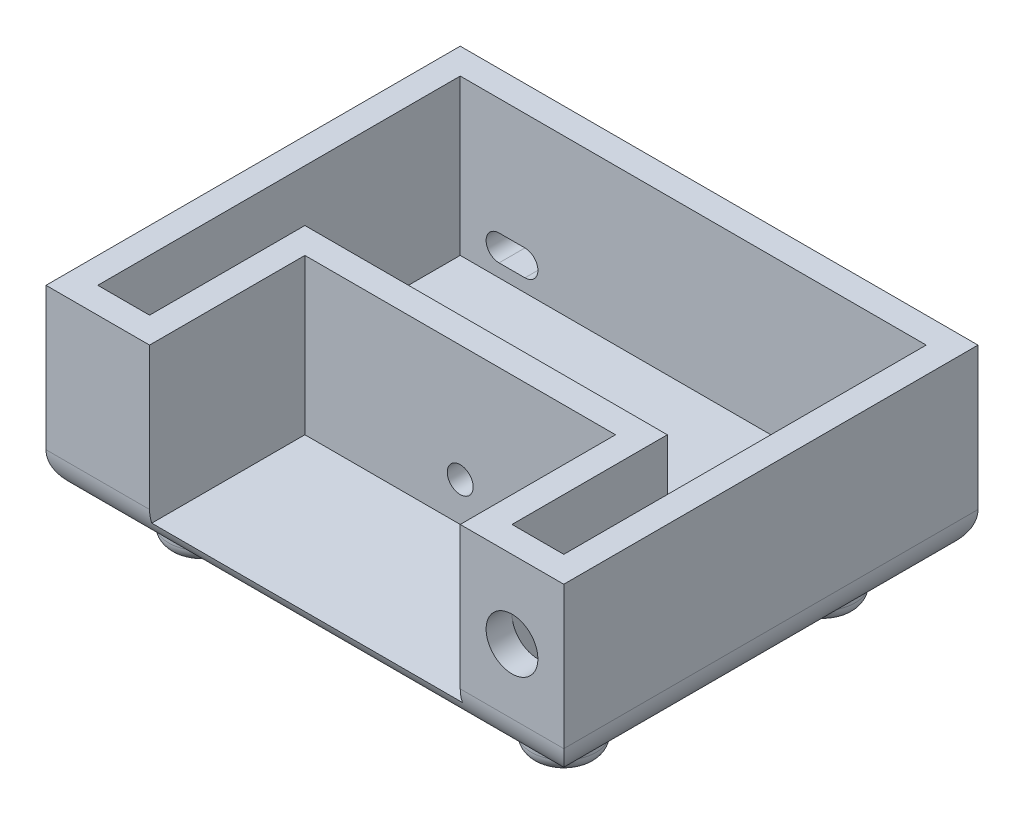
from build123d import *

# Parameters (mm, degrees)
SKETCH2_W           = 200
SKETCH2_H           = 160
BOSS_EXTRUDE1_DEPTH = 10
BOSS_EXTRUDE2_DEPTH = 60
SKETCH8_R           = 12.5
BOSS_EXTRUDE6_DEPTH = 15
FILLET2_R           = 5
CUT_EXTRUDE4_DEPTH  = 15
SKETCH10_R          = 10
CUT_EXTRUDE5_DEPTH  = 10
SKETCH7_R           = 5
CUT_EXTRUDE6_DEPTH  = 10
CUT_EXTRUDE7_DEPTH  = 10
FILLET5_R           = 15


with BuildPart() as part:
    # Sketch2 → Boss-Extrude1 (new body)
    with BuildSketch(Plane(origin=(0, 0, 0), x_dir=(1, 0, 0), z_dir=(0, 1, 0))):
        Rectangle(SKETCH2_W, SKETCH2_H)
    extrude(amount=BOSS_EXTRUDE1_DEPTH)

    # Sketch3 → Boss-Extrude2 (add)
    with BuildSketch(Plane(origin=(0, 10, 0), x_dir=(1, 0, 0), z_dir=(0, 1, 0))):
        Polygon((-100, 80), (100, 80), (100, -80), (60, -80), (60, -20), (-60, -20), (-60, -80), (-100, -80), align=None)
        Polygon((90, 70), (90, -70), (70, -70), (70, -10), (-70, -10), (-70, -70), (-90, -70), (-90, 70), align=None, mode=Mode.SUBTRACT)
    extrude(amount=BOSS_EXTRUDE2_DEPTH)

    # Sketch8 → Boss-Extrude6 (add)
    with BuildSketch(Plane.XZ):
        with Locations(Location((70, 50, 0), (0, 0, 90))):
            Circle(SKETCH8_R)
        with Locations(Location((-70, 50, 0), (0, 0, 90))):
            Circle(SKETCH8_R)
        with Locations(Location((70, -50, 0), (0, 0, 90))):
            Circle(SKETCH8_R)
        with Locations(Location((-70, -50, 0), (0, 0, 90))):
            Circle(SKETCH8_R)
    extrude(amount=BOSS_EXTRUDE6_DEPTH)

    # Fillet2
    fillet2_edges = [part.edges().sort_by_distance(p)[0] for p in [
        (70, -15, 37.5),
        (-70, -15, 37.5),
        (70, -15, -62.5),
        (-70, -15, -62.5),
    ]]
    fillet(fillet2_edges, radius=FILLET2_R)

    # Sketch9 → Cut-Extrude4 (cut)
    with BuildSketch(Plane(origin=(0, 0, -80), x_dir=(-1, 0, 0), z_dir=(0, 0, -1))):
        with BuildLine():
            Line((65, 25), (75, 25))
            ThreePointArc((75, 25), (80, 20), (75, 15))
            Line((75, 15), (65, 15))
            ThreePointArc((65, 15), (60, 20), (65, 25))
        make_face()
    extrude(amount=-CUT_EXTRUDE4_DEPTH, mode=Mode.SUBTRACT)

    # Sketch10 → Cut-Extrude5 (cut)
    with BuildSketch(Plane.XY.offset(80)):
        with Locations((80, 40)):
            Circle(SKETCH10_R)
    extrude(amount=-CUT_EXTRUDE5_DEPTH, mode=Mode.SUBTRACT)

    # Sketch7 → Cut-Extrude6 (cut)
    with BuildSketch(Plane.XY.offset(20)):
        with Locations((0, 25)):
            Circle(SKETCH7_R)
    extrude(amount=-CUT_EXTRUDE6_DEPTH, mode=Mode.SUBTRACT)

    # Sketch11 → Cut-Extrude7 (cut)
    with BuildSketch(Plane.XY.offset(20)):
        with BuildLine():
            Line((47.237449464, 27.403784995), (47.237449464, 17.403784995))
            ThreePointArc((47.237449464, 17.403784995), (44.237449464, 14.403784995), (41.237449464, 17.403784995))
            Line((41.237449464, 17.403784995), (41.237449464, 27.403784995))
            ThreePointArc((41.237449464, 27.403784995), (44.237449464, 30.403784995), (47.237449464, 27.403784995))
        make_face()
    extrude(amount=-CUT_EXTRUDE7_DEPTH, mode=Mode.SUBTRACT)

    # Fillet5
    # the kernel refuses this fillet: 15 mm, written as the material it takes off along each edge
    with BuildSketch(Plane(origin=(-137.5, 0, -80), x_dir=(0, 0, 1), z_dir=(1, 0, 0)), Plane(origin=(137.5, 0, 80), x_dir=(0, 0, -1), z_dir=(-1, 0, 0))) as fillet5_piece_1:
        with BuildLine():
            CenterArc((FILLET5_R, -FILLET5_R), FILLET5_R, 90, 90)
            Line((0, -FILLET5_R), (0, 0))
            Line((0, 0), (FILLET5_R, 0))
        make_face()
    extrude(amount=275, mode=Mode.SUBTRACT)
    with BuildSketch(Plane(origin=(100, 0, -117.5), x_dir=(-1, 0, 0), z_dir=(0, 0, 1)), Plane(origin=(-100, 0, 117.5), x_dir=(1, 0, 0), z_dir=(0, 0, -1))) as fillet5_piece_2:
        with BuildLine():
            CenterArc((FILLET5_R, -FILLET5_R), FILLET5_R, 90, 90)
            Line((0, -FILLET5_R), (0, 0))
            Line((0, 0), (FILLET5_R, 0))
        make_face()
    extrude(amount=235, mode=Mode.SUBTRACT)


solid = part.part
